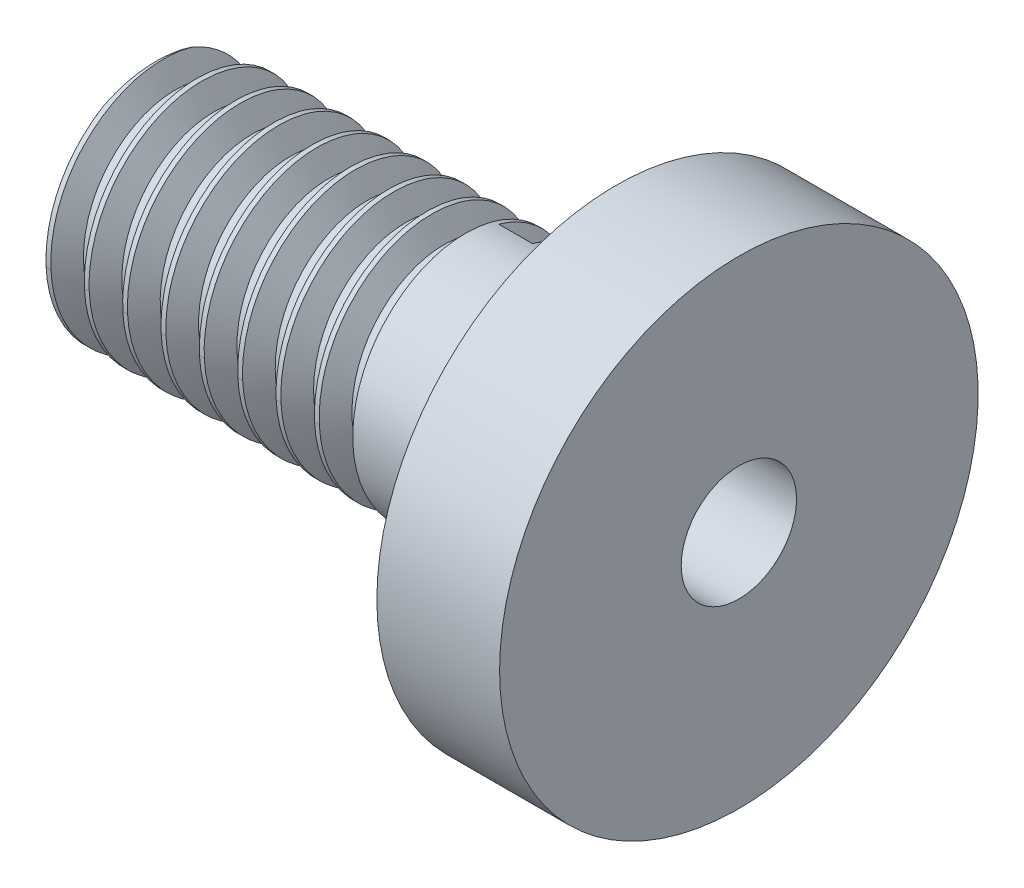
from build123d import *

# Parameters (mm, degrees)
THREAD1_PITCH = 0.79375


with BuildPart() as part:
    # Sketch1 → Revolve1 (revolve)
    with BuildSketch(Plane(origin=(0, 0, 0), x_dir=(1, 0, 0), z_dir=(0, 1, 0)), mode=Mode.PRIVATE) as revolve1_sk:
        Polygon((-9.525, 1.1938), (2.54, 1.1938), (2.54, 4.953), (0, 4.953), (0, 2.413), (-9.525, 2.413), align=None)
    revolve(revolve1_sk.sketch.rotate(Axis((0, 0, 0), (1, 0, 0)), 180), axis=Axis((0, 0, 0), (1, 0, 0)))

    # Thread1: arcs per turn and ends read off the stored shape
    # Thread1: the profile of Thread Profile1 profile screwed along a right-hand helix through 11.2 turns, 8 arcs to a turn; built about Z, then put on its axis
    thread1_z = Axis((0, 0, 0), (0, 0, 1))
    thread1_corners = [(2.4133, 0, -0.000173205), (2.4133, 0, 0.694704453), (1.983370212, 0, 0.446484374), (1.983370212, 0, 0.248046874)]
    with BuildLine(mode=Mode.PRIVATE) as thread1_profile:
        Line(thread1_corners[0], thread1_corners[1])
        Line(thread1_corners[1], thread1_corners[2])
        Line(thread1_corners[2], thread1_corners[3])
        Line(thread1_corners[3], thread1_corners[0])
    thread1_cap = Face(thread1_profile.wire())
    thread1_turn_angles = [0, 22.5, 45, 67.5, 90, 112.5, 135, 157.5, 180, 202.5, 225, 247.5, 270, 292.5, 315, 337.5, 360]
    thread1_turn_weights = [1, 0.9238795325112867, 1, 0.9238795325112867, 1, 0.9238795325112867, 1, 0.9238795325112867, 1, 0.9238795325112867, 1, 0.9238795325112867, 1, 0.9238795325112867, 1, 0.9238795325112867, 1]
    thread1_turn_rails = [Edge.make_bspline([Vector(p[0], p[1], 0).rotate(thread1_z, thread1_turn_angles[k]) / thread1_turn_weights[k] + Vector(0, 0, p[2] + THREAD1_PITCH * thread1_turn_angles[k] / 360) for k in range(17)], [0, 0, 0, 1, 1, 2, 2, 3, 3, 4, 4, 5, 5, 6, 6, 7, 7, 8, 8, 8], 2, thread1_turn_weights) for p in thread1_corners]
    thread1_turn_sides = [Face.make_surface_from_curves(thread1_turn_rails[p[0]], thread1_turn_rails[p[1]]) for p in [(0, 1), (1, 2), (2, 3), (3, 0)]]
    thread1_last_angles = [3960, 3982.5, 4005, 4018.5, 4032]
    thread1_last_weights = [1, 0.9238795325112867, 1, 0.9723699203976766, 1]
    thread1_last_rails = [Edge.make_bspline([Vector(p[0], p[1], 0).rotate(thread1_z, thread1_last_angles[k]) / thread1_last_weights[k] + Vector(0, 0, p[2] + THREAD1_PITCH * thread1_last_angles[k] / 360) for k in range(5)], [0, 0, 0, 1, 1, 2, 2, 2], 2, thread1_last_weights) for p in thread1_corners]
    thread1_last_sides = [Face.make_surface_from_curves(thread1_last_rails[p[0]], thread1_last_rails[p[1]]) for p in [(0, 1), (1, 2), (2, 3), (3, 0)]]
    thread1 = Plane(origin=(-12.065, 0, 0), x_dir=(0, 0, -1), z_dir=(1, 0, 0)) * Solid(Shell([*[p.moved(Location((0, 0, THREAD1_PITCH * i))) for i in range(11) for p in thread1_turn_sides], *thread1_last_sides, thread1_cap, thread1_cap.rotate(thread1_z, 4032).moved(Location((0, 0, THREAD1_PITCH * 4032 / 360)))]))
    add(thread1, mode=Mode.SUBTRACT)


solid = part.part
